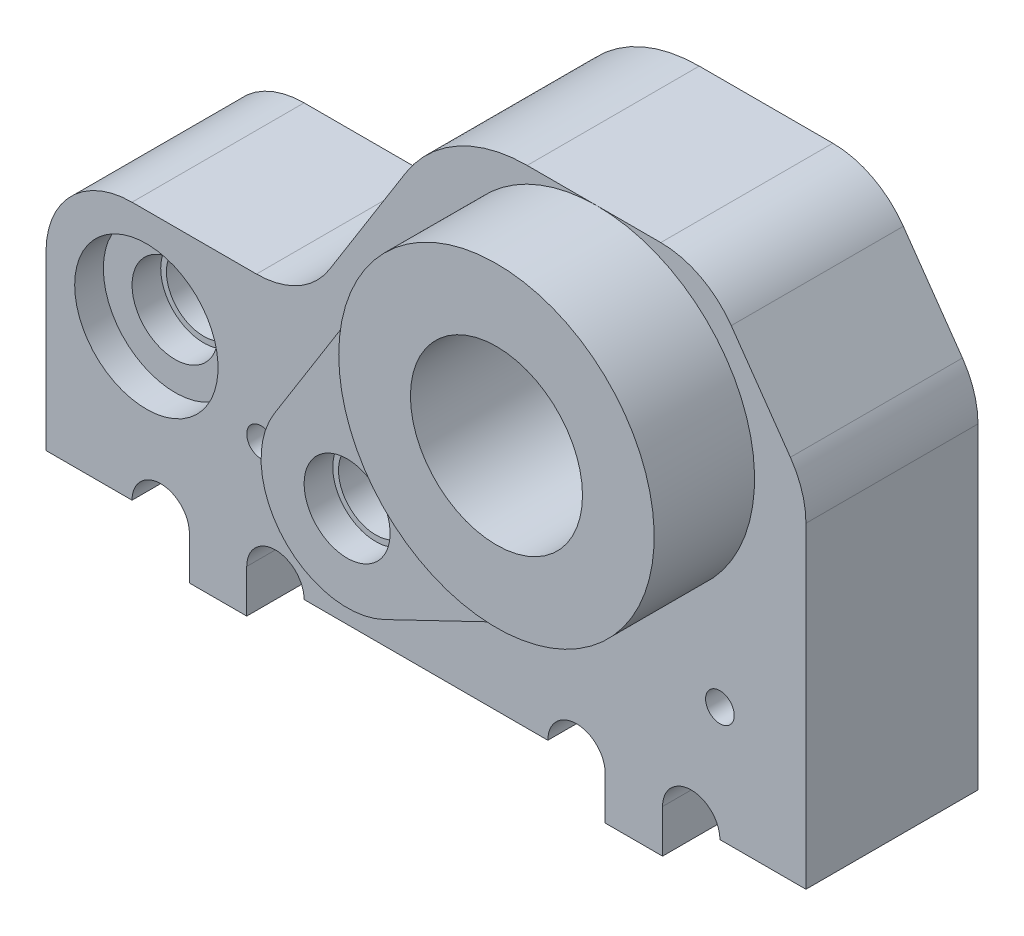
from build123d import *
from build123d.topology import SkipClean

# Parameters (mm, degrees)
SKETCH1_W                            = 26.5
SKETCH1_H                            = 6
BOSS_EXTRUDE1_DEPTH                  = 17
SKETCH2_R                            = 1.5
CUT_EXTRUDE1_DEPTH                   = 1
SKETCH3_R                            = 1.3
CUT_EXTRUDE2_DEPTH                   = 32.878676259
SKETCH4_R                            = 3
CUT_EXTRUDE3_DEPTH                   = 33.050741021
SKETCH5_R                            = 2.5
CUT_EXTRUDE4_DEPTH                   = 1.5
SKETCH6_R                            = 1.5
CUT_EXTRUDE8_DEPTH                   = 1
SKETCH7_R                            = 1.3
CUT_EXTRUDE9_DEPTH                   = 32.678068123
CUT_EXTRUDE10_START                  = -1
SKETCH8_R                            = 2.5
CUT_EXTRUDE10_DEPTH                  = 1
CUT_EXTRUDE11_START                  = -1
SKETCH9_R                            = 1.5
CUT_EXTRUDE11_DEPTH                  = 1
SKETCH10_R                           = 5.5
SKETCH10_R_2                         = 3
BOSS_EXTRUDE2_DEPTH                  = 3.5
SKETCH11_R                           = 3
SKETCH11_R_2                         = 1.3
BOSS_EXTRUDE4_DEPTH                  = 2
CUT_EXTRUDE12_START                  = -1
SKETCH12_R                           = 1.5
CUT_EXTRUDE12_DEPTH                  = 1
SKETCH17_W                           = 2
SKETCH17_H                           = 6
BOSS_EXTRUDE6_DEPTH                  = 1.5
SKETCH18_R                           = 1
CUT_EXTRUDE17_DEPTH                  = 33.050741021
CHAMFER2_SIZE                        = 5
CHAMFER2_SIZE2                       = 3.5
FILLET11_R                           = 3
BOSS_EXTRUDE7_DEPTH                  = 2
CUT_EXTRUDE19_DEPTH                  = 33.050741021
FILLET13_R                           = 5
FILLET14_R                           = 3
FILLET15_R                           = 3
SKIZZE1_R                            = 0.5
SCHNITT_LINEAR_AUSTRAGEN1_DEPTH      = 33.050741021
SPIEGELN1_OUTLINE_R                  = 3
SPIEGELN1_OUTLINE_R_2                = 2.5
SPIEGELN1_OUTLINE_R_3                = 0.5
SPIEGELN1_OUTLINE_R_4                = 1.5
SPIEGELN1_DEPTH                      = 6
SPIEGELN1_START                      = 6
SPIEGELN1_2_OUTLINE_R                = 5.5
SPIEGELN1_2_OUTLINE_R_2              = 3
SPIEGELN1_2_DEPTH                    = 3.5
SPIEGELN1_3_OUTLINE_R                = 1.5
SPIEGELN1_3_DEPTH                    = 2
SPIEGELN1_START_2                    = 1.5
SPIEGELN1_4_OUTLINE_R                = 1.5
SPIEGELN1_4_OUTLINE_R_2              = 1.3
SPIEGELN1_4_OUTLINE_R_3              = 2.5
SPIEGELN1_4_DEPTH                    = 3.5
SPIEGELN1_START_3                    = 1
SPIEGELN1_5_OUTLINE_R                = 1.5
SPIEGELN1_5_OUTLINE_R_2              = 1.3
SPIEGELN1_5_DEPTH                    = 6
SPIEGELN1_START_4                    = 2.5
SPIEGELN1_6_OUTLINE_R                = 1.5
SPIEGELN1_6_OUTLINE_R_2              = 1.3
SPIEGELN1_6_DEPTH                    = 1.5
SCHNITT_LINEAR_AUSTRAGEN2_DEPTH      = 31.409702399
SCHNITT_LINEAR_AUSTRAGEN2_DEPTH_BACK = 31.409702399
SKIZZE2_W                            = 26.5
SKIZZE2_H                            = 9.5


# Read off the part's stored shape, not the designer's step: Spiegeln1
with BuildPart() as part:
    # Sketch1 → Boss-Extrude1 (new body)
    with BuildSketch(Plane(origin=(0, 0, 0), x_dir=(1, 0, 0), z_dir=(0, 1, 0))):
        with Locations((13.25, 3)):
            Rectangle(SKETCH1_W, SKETCH1_H)
    extrude(amount=BOSS_EXTRUDE1_DEPTH)

    # Sketch2 → Cut-Extrude1 (cut)
    with BuildSketch(Plane.XY):
        with Locations((12.5, 5.5)):
            Circle(SKETCH2_R)
    extrude(amount=-CUT_EXTRUDE1_DEPTH, mode=Mode.SUBTRACT)

    # Sketch3 → Cut-Extrude2 (cut, through all)
    with BuildSketch(Plane.XY.offset(-1)):
        with Locations((12.5, 5.5)):
            Circle(SKETCH3_R)
    extrude(amount=-CUT_EXTRUDE2_DEPTH, mode=Mode.SUBTRACT)

    # Sketch4 → Cut-Extrude3 (cut, through all)
    with BuildSketch(Plane.XY):
        with Locations((19.208203932, 11.5)):
            Circle(SKETCH4_R)
    extrude(amount=-CUT_EXTRUDE3_DEPTH, mode=Mode.SUBTRACT)

    # Sketch5 → Cut-Extrude4 (cut)
    with BuildSketch(Plane.XY):
        with Locations((3.5, 5.5)):
            Circle(SKETCH5_R)
    extrude(amount=-CUT_EXTRUDE4_DEPTH, mode=Mode.SUBTRACT)

    # Sketch6 → Cut-Extrude8 (cut)
    with BuildSketch(Plane.XY.offset(-1.5)):
        with Locations((3.5, 5.5)):
            Circle(SKETCH6_R)
    extrude(amount=-CUT_EXTRUDE8_DEPTH, mode=Mode.SUBTRACT)

    # Sketch7 → Cut-Extrude9 (cut, through all)
    with BuildSketch(Plane.XY.offset(-2.5)):
        with Locations((3.5, 5.5)):
            Circle(SKETCH7_R)
    extrude(amount=-CUT_EXTRUDE9_DEPTH, mode=Mode.SUBTRACT)

    # Sketch8 → Cut-Extrude10 (cut)
    with BuildSketch(Plane(origin=(0, 0, -6), x_dir=(-1, 0, 0), z_dir=(0, 0, -1)).offset(CUT_EXTRUDE10_START)):
        with Locations(Location((-3.5, 5.5, 0), (0, 0, 180))):
            Circle(SKETCH8_R)
    extrude(amount=CUT_EXTRUDE10_DEPTH, mode=Mode.SUBTRACT)

    # Sketch9 → Cut-Extrude11 (cut)
    with BuildSketch(Plane(origin=(0, 0, -5), x_dir=(-1, 0, 0), z_dir=(0, 0, -1)).offset(CUT_EXTRUDE11_START)):
        with Locations(Location((-3.5, 5.5, 0), (0, 0, 180))):
            Circle(SKETCH9_R)
    extrude(amount=CUT_EXTRUDE11_DEPTH, mode=Mode.SUBTRACT)

    # Sketch10 → Boss-Extrude2 (add)
    with BuildSketch(Plane(origin=(0, 0, -6), x_dir=(-1, 0, 0), z_dir=(0, 0, -1))):
        with Locations(Location((-19.208203932, 11.5, 0), (0, 0, 90))):
            Circle(SKETCH10_R)
        with Locations(Location((-19.208203932, 11.5, 0), (0, 0, 180))):
            Circle(SKETCH10_R_2, mode=Mode.SUBTRACT)
    extrude(amount=BOSS_EXTRUDE2_DEPTH)

    # Sketch11 → Boss-Extrude4 (add)
    with BuildSketch(Plane(origin=(0, 0, -6), x_dir=(-1, 0, 0), z_dir=(0, 0, -1))):
        with Locations(Location((-12.5, 5.5, 0), (0, 0, 180))):
            Circle(SKETCH11_R)
        with Locations(Location((-12.5, 5.5, 0), (0, 0, 180))):
            Circle(SKETCH11_R_2, mode=Mode.SUBTRACT)
    extrude(amount=BOSS_EXTRUDE4_DEPTH)

    # Sketch12 → Cut-Extrude12 (cut)
    with BuildSketch(Plane(origin=(0, 0, -8), x_dir=(-1, 0, 0), z_dir=(0, 0, -1)).offset(CUT_EXTRUDE12_START)):
        with Locations(Location((-12.5, 5.5, 0), (0, 0, 180))):
            Circle(SKETCH12_R)
    extrude(amount=CUT_EXTRUDE12_DEPTH, mode=Mode.SUBTRACT)

    # Sketch17 → Boss-Extrude6 (add)
    with BuildSketch(Plane.XZ):
        with Locations((6, -3)):
            Rectangle(SKETCH17_W, SKETCH17_H)
        with Locations((20.5, -3)):
            Rectangle(SKETCH17_W, SKETCH17_H)
    extrude(amount=BOSS_EXTRUDE6_DEPTH)

    # Sketch18 → Cut-Extrude17 (cut, through all)
    with BuildSketch(Plane(origin=(0, 0, -6), x_dir=(-1, 0, 0), z_dir=(0, 0, -1))):
        with Locations((-22.5, 0)):
            Circle(SKETCH18_R)
        with Locations((-18.5, 0)):
            Circle(SKETCH18_R)
        with Locations((-8, 0)):
            Circle(SKETCH18_R)
        with Locations((-4, 0)):
            Circle(SKETCH18_R)
    extrude(amount=-CUT_EXTRUDE17_DEPTH, mode=Mode.SUBTRACT)

    # Chamfer2
    chamfer2_edges = [part.edges().sort_by_distance(p)[0] for p in [
        (26.5, 17, -3),
    ]]
    chamfer2_side = [part.faces().sort_by_distance(p)[0] for p in [
        (26.5, 8.5, -3),
    ]]
    chamfer(chamfer2_edges, length=CHAMFER2_SIZE, length2=CHAMFER2_SIZE2, reference=chamfer2_side[0])

    # Fillet11
    fillet11_edges = [part.edges().sort_by_distance(p)[0] for p in [
        (23, 17, -3),
        (26.5, 12, -3),
    ]]
    fillet(fillet11_edges, radius=FILLET11_R)

    # Sketch19 → Boss-Extrude7 (add)
    with BuildSketch(Plane(origin=(0, 0, -6), x_dir=(-1, 0, 0), z_dir=(0, 0, -1))):
        with BuildLine():
            Line((-14.547099294, 14.419606745), (-9.957579288, 7.09251277))
            ThreePointArc((-9.957579288, 7.09251277), (-14.736067977, 7.5), (-13.800160725, 2.796376119))
            Line((-13.800160725, 2.796376119), (-21.591831928, 6.543356218))
            ThreePointArc((-21.591831928, 6.543356218), (-15.108745974, 7.833333333), (-14.547099294, 14.419606745))
        make_face()
    extrude(amount=BOSS_EXTRUDE7_DEPTH)

    # Sketch20 → Cut-Extrude19 (cut, through all)
    with BuildSketch(Plane(origin=(0, 0, -6), x_dir=(-1, 0, 0), z_dir=(0, 0, -1))):
        Polygon((0, 17), (-14.011012575, 17), (-9, 9), (0, 9), align=None)
    extrude(amount=-CUT_EXTRUDE19_DEPTH, mode=Mode.SUBTRACT)

    # Fillet13
    fillet13_edges = [part.edges().sort_by_distance(p)[0] for p in [
        (14.011012575, 17, -3),
    ]]
    fillet(fillet13_edges, radius=FILLET13_R)

    # Fillet14
    fillet14_edges = [part.edges().sort_by_distance(p)[0] for p in [
        (9, 9, -3),
    ]]
    fillet(fillet14_edges, radius=FILLET14_R)

    # Fillet15
    fillet15_edges = [part.edges().sort_by_distance(p)[0] for p in [
        (0, 9, -3),
    ]]
    fillet(fillet15_edges, radius=FILLET15_R)

    # Skizze1 → Schnitt-Linear austragen1 (cut, through all)
    with BuildSketch(Plane(origin=(0, 0, -6), x_dir=(-1, 0, 0), z_dir=(0, 0, -1))):
        with Locations((-23.5, 4)):
            Circle(SKIZZE1_R)
        with Locations((-7.5, 4)):
            Circle(SKIZZE1_R)
    extrude(amount=-SCHNITT_LINEAR_AUSTRAGEN1_DEPTH, mode=Mode.SUBTRACT)

    # Spiegeln1 outline → Spiegeln1 (add)
    with SkipClean():  # the faces are left unmerged after this step: merging them gives an invalid solid
        with BuildSketch(Plane.XY):
            with BuildLine():
                Line((21.438033315, 17), (16.779018718, 17))
                ThreePointArc((16.779018718, 17), (14.357339523, 16.374410803), (12.541650865, 14.65418795))
                Line((12.541650865, 14.65418795), (9.881617026, 10.40748723))
                ThreePointArc((9.881617026, 10.40748723), (8.792203831, 9.375353518), (7.339196314, 9))
                Line((7.339196314, 9), (3, 9))
                ThreePointArc((3, 9), (0.878679656, 8.121320344), (0, 6))
                Line((0, 6), (0, 0))
                Line((0, 0), (3, 0))
                ThreePointArc((3, 0), (4, 1), (5, 0))
                Line((5, 0), (5, -1.5))
                Line((5, -1.5), (7, -1.5))
                Line((7, -1.5), (7, 0))
                ThreePointArc((7, 0), (8, 1), (9, 0))
                Line((9, 0), (17.5, 0))
                ThreePointArc((17.5, 0), (18.5, 1), (19.5, 0))
                Line((19.5, 0), (19.5, -1.5))
                Line((19.5, -1.5), (21.5, -1.5))
                Line((21.5, -1.5), (21.5, 0))
                ThreePointArc((21.5, 0), (22.5, 1), (23.5, 0))
                Line((23.5, 0), (26.5, 0))
                Line((26.5, 0), (26.5, 11.054333308))
                ThreePointArc((26.5, 11.054333308), (26.361213666, 11.956251462), (25.957695762, 12.774720341))
                Line((25.957695762, 12.774720341), (23.895729077, 15.720387033))
                ThreePointArc((23.895729077, 15.720387033), (22.823464458, 16.660936029), (21.438033315, 17))
            make_face()
            with Locations((19.208203932, 11.5)):
                Circle(SPIEGELN1_OUTLINE_R, mode=Mode.SUBTRACT)
            with Locations((3.5, 5.5)):
                Circle(SPIEGELN1_OUTLINE_R_2, mode=Mode.SUBTRACT)
            with Locations((7.5, 4)):
                Circle(SPIEGELN1_OUTLINE_R_3, mode=Mode.SUBTRACT)
            with Locations((23.5, 4)):
                Circle(SPIEGELN1_OUTLINE_R_3, mode=Mode.SUBTRACT)
            with Locations((12.5, 5.5)):
                Circle(SPIEGELN1_OUTLINE_R_4, mode=Mode.SUBTRACT)
        extrude(amount=SPIEGELN1_DEPTH)

    # Spiegeln1 2 outline → Spiegeln1 2 (add)
    with SkipClean():  # the faces are left unmerged after this step: merging them gives an invalid solid
        with BuildSketch(Plane.XY.offset(SPIEGELN1_START)):
            with Locations((19.208203932, 11.5)):
                Circle(SPIEGELN1_2_OUTLINE_R)
            with Locations((19.208203932, 11.5)):
                Circle(SPIEGELN1_2_OUTLINE_R_2, mode=Mode.SUBTRACT)
        extrude(amount=SPIEGELN1_2_DEPTH)

    # Spiegeln1 3 outline → Spiegeln1 3 (add)
    with SkipClean():  # the faces are left unmerged after this step: merging them gives an invalid solid
        with BuildSketch(Plane.XY.offset(SPIEGELN1_START)):
            with BuildLine():
                ThreePointArc((21.591831928, 6.543356218), (15.108745973, 7.833333333), (14.547099293, 14.419606745))
                Line((14.547099293, 14.419606745), (9.957579288, 7.09251277))
                ThreePointArc((9.957579288, 7.09251277), (10.263932023, 3.5), (13.800160725, 2.796376119))
                Line((13.800160725, 2.796376119), (21.591831928, 6.543356218))
            make_face()
            with Locations((12.5, 5.5)):
                Circle(SPIEGELN1_3_OUTLINE_R, mode=Mode.SUBTRACT)
        extrude(amount=SPIEGELN1_3_DEPTH)

    # Spiegeln1 4 outline → Spiegeln1 4 (add)
    # profile 1 of 2: a face of its own
    with SkipClean():  # the faces are left unmerged after this step: merging them gives an invalid solid
        with BuildSketch(Plane.XY.offset(SPIEGELN1_START_2)):
            with Locations((12.5, 5.5)):
                Circle(SPIEGELN1_4_OUTLINE_R)
            with Locations((12.5, 5.5)):
                Circle(SPIEGELN1_4_OUTLINE_R_2, mode=Mode.SUBTRACT)
        # profile 2 of 2: a face of its own
        with BuildSketch(Plane.XY.offset(SPIEGELN1_START_2)):
            with Locations((3.5, 5.5)):
                Circle(SPIEGELN1_4_OUTLINE_R_3)
            with Locations((3.5, 5.5)):
                Circle(SPIEGELN1_4_OUTLINE_R, mode=Mode.SUBTRACT)
        extrude(amount=SPIEGELN1_4_DEPTH)

    # Spiegeln1 5 outline → Spiegeln1 5 (add)
    with SkipClean():  # the faces are left unmerged after this step: merging them gives an invalid solid
        with BuildSketch(Plane.XY.offset(SPIEGELN1_START_3)):
            with Locations((12.5, 5.5)):
                Circle(SPIEGELN1_5_OUTLINE_R)
            with Locations((12.5, 5.5)):
                Circle(SPIEGELN1_5_OUTLINE_R_2, mode=Mode.SUBTRACT)
        extrude(amount=SPIEGELN1_5_DEPTH)

    # Spiegeln1 6 outline → Spiegeln1 6 (add)
    with SkipClean():  # the faces are left unmerged after this step: merging them gives an invalid solid
        with BuildSketch(Plane.XY.offset(SPIEGELN1_START_4)):
            with Locations((3.5, 5.5)):
                Circle(SPIEGELN1_6_OUTLINE_R)
            with Locations((3.5, 5.5)):
                Circle(SPIEGELN1_6_OUTLINE_R_2, mode=Mode.SUBTRACT)
        extrude(amount=SPIEGELN1_6_DEPTH)

    # Skizze2 → Schnitt-Linear austragen2 (cut, two sides: drawn at the far end of the back side and taken through both)
    with BuildSketch(Plane(origin=(0, 5.5, 0), x_dir=(1, 0, 0), z_dir=(0, 1, 0)).offset(-SCHNITT_LINEAR_AUSTRAGEN2_DEPTH_BACK)):
        with Locations((13.25, 4.75)):
            Rectangle(SKIZZE2_W, SKIZZE2_H)
    extrude(amount=SCHNITT_LINEAR_AUSTRAGEN2_DEPTH + SCHNITT_LINEAR_AUSTRAGEN2_DEPTH_BACK, mode=Mode.SUBTRACT)


solid = part.part
